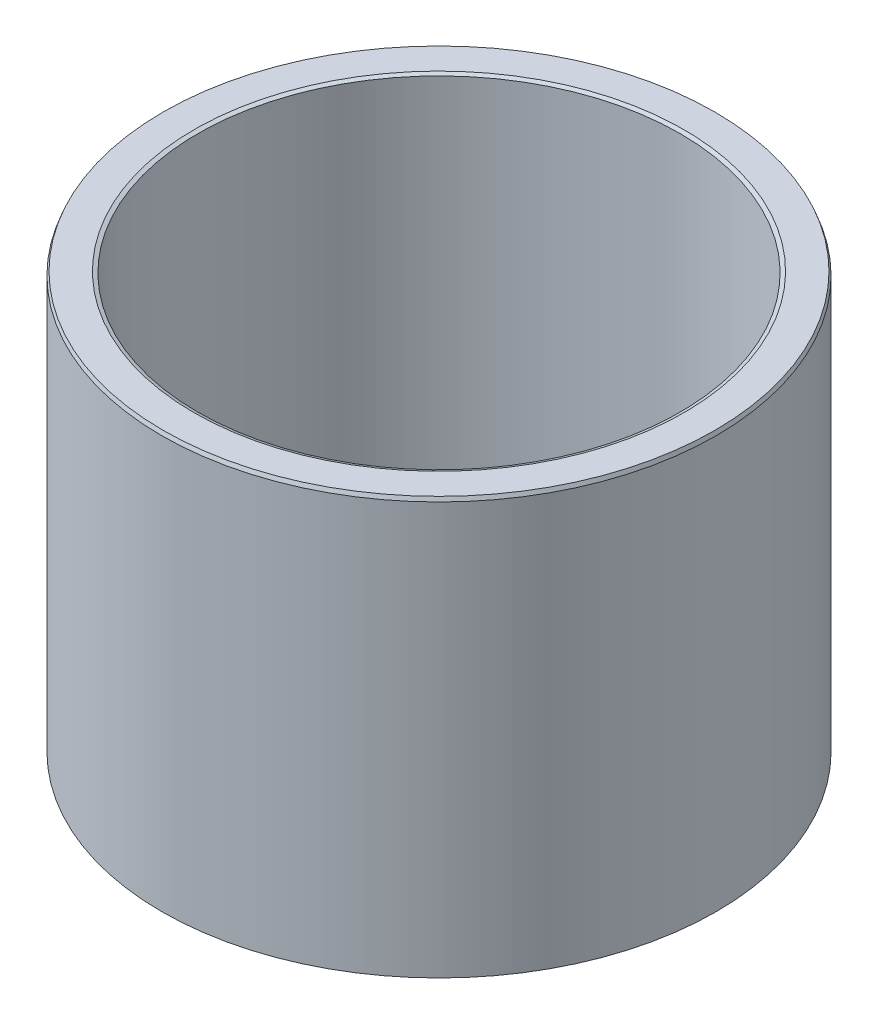
from build123d import *
from OCP.BRepFilletAPI import BRepFilletAPI_MakeChamfer

# Parameters (mm, degrees)
SKETCH1_R           = 47.5
BOSS_EXTRUDE1_DEPTH = 71.536402735
SKETCH2_R           = 41.326178962
CUT_EXTRUDE1_DEPTH  = 99.132343884
CHAMFER1_SIZE       = 0.660281023
CHAMFER1_SIZE2      = 0.250094078


with BuildPart() as part:
    # Sketch1 → Boss-Extrude1 (new body)
    with BuildSketch(Plane(origin=(0, 0, 0), x_dir=(1, 0, 0), z_dir=(0, 1, 0))):
        Circle(SKETCH1_R)
    extrude(amount=BOSS_EXTRUDE1_DEPTH)

    # Sketch2 → Cut-Extrude1 (cut, through all)
    with BuildSketch(Plane(origin=(0, 0, 0), x_dir=(1, 0, 0), z_dir=(0, 1, 0))):
        Circle(SKETCH2_R)
    extrude(amount=CUT_EXTRUDE1_DEPTH, mode=Mode.SUBTRACT)

    # Chamfer1: one chamfer whose edges measure the first distance from different faces: ONE call of the kernel's chamfer builder (chamfer() names one face for all edges)
    chamfer1_edges_1 = [part.edges().sort_by_distance(p)[0] for p in [
        (-41.326178962, 71.536402735, 0),
    ]]
    chamfer1_side_1 = [part.faces().sort_by_distance(p)[0] for p in [
        (-46.156497116, 71.536402735, 0),
    ]]
    chamfer1_edges_2 = [part.edges().sort_by_distance(p)[0] for p in [
        (-41.326178962, 0, 0),
    ]]
    chamfer1_side_2 = [part.faces().sort_by_distance(p)[0] for p in [
        (-41.326178962, 35.768201367, 0),
    ]]
    chamfer1_edges_3 = [part.edges().sort_by_distance(p)[0] for p in [
        (-47.5, 0, 0),
    ]]
    chamfer1_side_3 = [part.faces().sort_by_distance(p)[0] for p in [
        (-46.156497116, 0, 0),
    ]]
    chamfer1_edges_4 = [part.edges().sort_by_distance(p)[0] for p in [
        (-47.5, 71.536402735, 0),
    ]]
    chamfer1_side_4 = [part.faces().sort_by_distance(p)[0] for p in [
        (-47.5, 35.768201367, 0),
    ]]
    chamfer1 = BRepFilletAPI_MakeChamfer(part.part.solid().wrapped)
    for e in chamfer1_edges_1:
        chamfer1.Add(CHAMFER1_SIZE, CHAMFER1_SIZE2, e.wrapped, chamfer1_side_1[0].wrapped)  # the first distance lies on this face
    for e in chamfer1_edges_2:
        chamfer1.Add(CHAMFER1_SIZE, CHAMFER1_SIZE2, e.wrapped, chamfer1_side_2[0].wrapped)  # the first distance lies on this face
    for e in chamfer1_edges_3:
        chamfer1.Add(CHAMFER1_SIZE, CHAMFER1_SIZE2, e.wrapped, chamfer1_side_3[0].wrapped)  # the first distance lies on this face
    for e in chamfer1_edges_4:
        chamfer1.Add(CHAMFER1_SIZE, CHAMFER1_SIZE2, e.wrapped, chamfer1_side_4[0].wrapped)  # the first distance lies on this face
    add(Compound.cast(chamfer1.Shape()), mode=Mode.REPLACE)


solid = part.part
